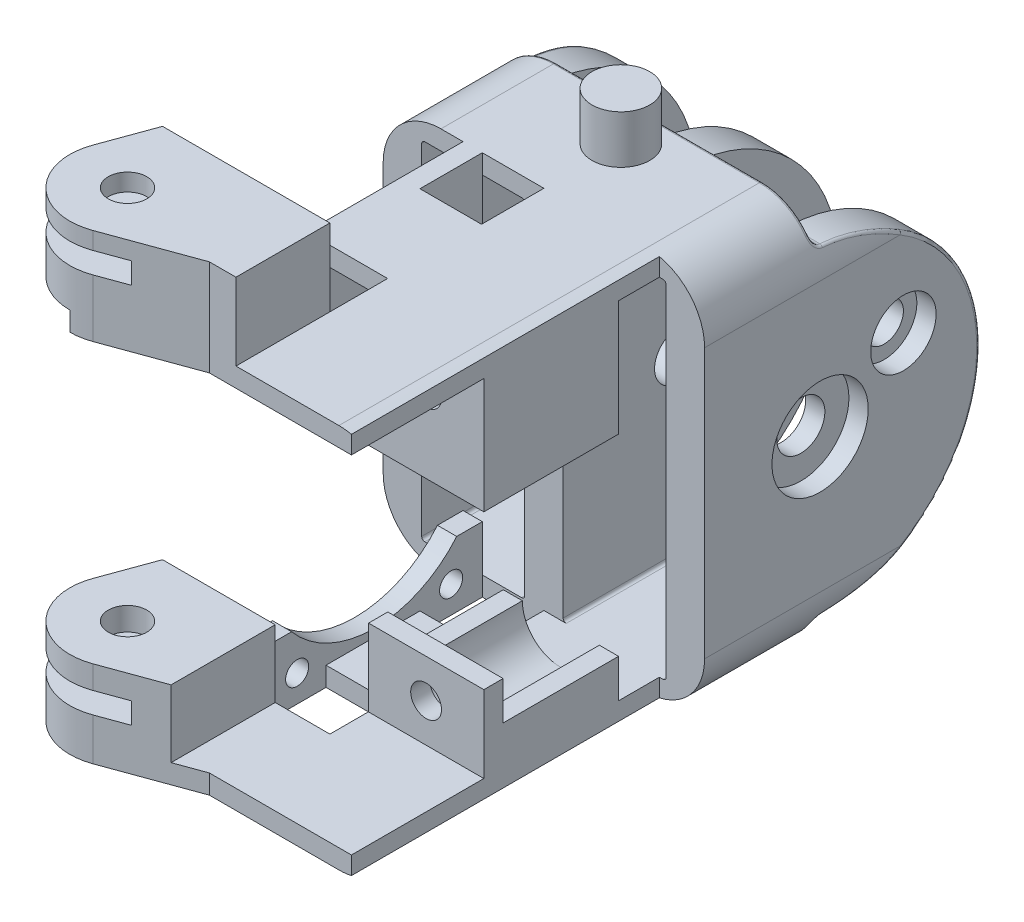
from build123d import *

# Parameters (mm, degrees)
BOSS_EXTRUDE1_DEPTH      = 20
BOSS_EXTRUDE1_DEPTH_BACK = 12
SKETCH1_W                = 16.7
SKETCH1_H                = 20
SKETCH9_R                = 1.5
BOSS_EXTRUDE4_DEPTH      = 2.5
BOSS_EXTRUDE5_START      = 2.5
SKETCH10_R               = 1.5
BOSS_EXTRUDE5_DEPTH      = 2.5
EXTRUDE43_START          = -10
EXTRUDE43_DEPTH          = 20
EXTRUDE44_DEPTH          = 27.982504177
EXTRUDE44_DEPTH_BACK     = 27.982504177
SKETCH_R                 = 1
EXTRUDE45_DEPTH          = 27.982504177
EXTRUDE45_DEPTH_BACK     = 27.982504177
SKETCH67_R               = 1.25
EXTRUDE46_DEPTH          = 27.982504177
EXTRUDE46_DEPTH_BACK     = 27.982504177
EXTRUDE49_DEPTH          = 9
EXTRUDE49_DEPTH_BACK     = 9
SKETCH71_W               = 27.384263627
SKETCH71_H               = 19.636512736
EXTRUDE50_DEPTH          = 29.312186927
EXTRUDE50_DEPTH_BACK     = 29.312186927
SKETCH72_R               = 0.8
EXTRUDE51_DEPTH          = 9
EXTRUDE51_DEPTH_BACK     = 9
SKETCH73_W               = 9.907288935
SKETCH73_H               = 19.904321568
EXTRUDE52_DEPTH          = 9
EXTRUDE52_DEPTH_BACK     = 9
SKETCH74_W               = 5.35
SKETCH74_H               = 6.12
SKETCH74_H_2             = 13.03291784
SKETCH74_H_3             = 12.21702605
EXTRUDE53_DEPTH          = 9
EXTRUDE53_DEPTH_BACK     = 9
SKETCH75_W               = 2
SKETCH75_H               = 2.12
SKETCH75_W_2             = 11.907865897
EXTRUDE54_DEPTH          = 9
EXTRUDE54_DEPTH_BACK     = 9
EXTRUDE55_START          = -6
SKETCH77_R               = 0.8
EXTRUDE55_DEPTH          = 6
SKETCH78_W               = 5.990569302
SKETCH78_H               = 5
EXTRUDE56_DEPTH          = 1
EXTRUDE57_START          = 4
SKETCH79_W               = 15
SKETCH79_H               = 6.5
EXTRUDE57_DEPTH          = 23.982504177
EXTRUDE58_START          = -4.2
SKETCH81_W               = 5.5
SKETCH81_H               = 15
SKETCH81_W_2             = 5.62
SKETCH81_H_2             = 10
EXTRUDE58_DEPTH          = 10
EXTRUDE59_START          = -4.2
SKETCH82_W               = 11.12
SKETCH82_H               = 20
EXTRUDE59_DEPTH          = 1
EXTRUDE60_START          = -4.2
SKETCH83_R               = 0.6
EXTRUDE60_DEPTH          = 2
EXTRUDE61_START          = -3.2
SKETCH84_W               = 3.24
SKETCH84_H               = 10
SKETCH84_W_2             = 3
SKETCH84_H_2             = 4
EXTRUDE61_DEPTH          = 3.2
EXTRUDE62_START          = -4.2
EXTRUDE62_DEPTH          = 1
EXTRUDE63_START          = -6.7
SKETCH86_R               = 2.5
EXTRUDE63_DEPTH          = 1.1
EXTRUDE66_DEPTH          = 1.5
SKETCH96_R               = 1
EXTRUDE69_DEPTH          = 4
EXTRUDE70_DEPTH          = 1
EXTRUDE71_START          = 3.1
SKETCH98_R               = 2.5
EXTRUDE71_DEPTH          = 1.1
EXTRUDE72_DEPTH          = 1
EXTRUDE72_DEPTH_BACK     = 1
EXTRUDE64_DEPTH          = 28.709304064
EXTRUDE64_DEPTH_BACK     = 28.709304064
FILLET23_R               = 1.6
FILLET24_R               = 1.6
EXTRUDE73_DEPTH          = 28.709304064
EXTRUDE73_DEPTH_BACK     = 2
SKETCH101_R              = 1
EXTRUDE74_DEPTH          = 1.5
EXTRUDE75_START          = -7.35
EXTRUDE75_DEPTH          = 21.359304064
EXTRUDE76_START          = 7.35
SKETCH104_R              = 2.5
EXTRUDE76_DEPTH          = 21.359304064
EXTRUDE77_START          = 7.35
SKETCH105_R              = 1.7
EXTRUDE77_DEPTH          = 21.359304064
FILLET25_R               = 3
FILLET26_R               = 0.4
FILLET27_R               = 0.16
FILLET28_R               = 0.16


# Read off the part's stored shape, not the designer's step: Extrude43
with BuildPart() as part:
    # Sketch1 → Boss-Extrude1 (new, two sides: drawn at the far end of the back side and taken through both)
    with BuildSketch(Plane.XY.offset(-BOSS_EXTRUDE1_DEPTH_BACK)):
        Rectangle(SKETCH1_W, SKETCH1_H)
    extrude(amount=BOSS_EXTRUDE1_DEPTH + BOSS_EXTRUDE1_DEPTH_BACK)

    # Sketch9 → Boss-Extrude4 (add)
    with BuildSketch(Plane(origin=(0, 10, 0), x_dir=(1, 0, 0), z_dir=(0, 1, 0))):
        with Locations(Location((0, 0, 0), (0, 0, 270))):
            Circle(SKETCH9_R)
    extrude(amount=BOSS_EXTRUDE4_DEPTH)

    # Sketch10 → Boss-Extrude5 (add)
    with BuildSketch(Plane.XZ.offset(10).offset(BOSS_EXTRUDE5_START)):
        with Locations(Location((0, 0, 0), (0, 0, 90))):
            Circle(SKETCH10_R)
    extrude(amount=-BOSS_EXTRUDE5_DEPTH)

    # Extrude43 outline → Extrude43 (add)
    with BuildSketch(Plane(origin=(0, 0, 0), x_dir=(1, 0, 0), z_dir=(0, 1, 0)).offset(EXTRUDE43_START)):
        with BuildLine():
            ThreePointArc((-9.659480729, -17.767791986), (-8.96172321, -20.915172759), (-5.814342437, -21.612930278))
            Line((-5.814342437, -21.612930278), (-1.382852918, -20))
            Line((-1.382852918, -20), (-8.35, -20))
            Line((-8.35, -20), (-8.35, -14.170023252))
            Line((-8.35, -14.170023252), (-9.659480729, -17.767791986))
        make_face()
    extrude(amount=EXTRUDE43_DEPTH)

    # Sketch → Extrude44 (cut, two sides: drawn at the far end of the back side and taken through both)
    with BuildSketch(Plane(origin=(0, 0, 0), x_dir=(1, 0, 0), z_dir=(0, 1, 0)).offset(-EXTRUDE44_DEPTH_BACK)):
        with Locations(Location((-6.840402867, -18.793852416, 0), (0, 0, 270))):
            Circle(SKETCH_R)
    extrude(amount=EXTRUDE44_DEPTH + EXTRUDE44_DEPTH_BACK, mode=Mode.SUBTRACT)

    # Sketch67 → Extrude45 (cut, two sides: drawn at the far end of the back side and taken through both)
    with BuildSketch(Plane(origin=(0, 0, 0), x_dir=(0, 0, -1), z_dir=(1, 0, 0)).offset(-EXTRUDE45_DEPTH_BACK)):
        with Locations((2, 0)):
            Circle(SKETCH67_R)
    extrude(amount=EXTRUDE45_DEPTH + EXTRUDE45_DEPTH_BACK, mode=Mode.SUBTRACT)

    # Sketch68 → Extrude46 (cut, two sides: drawn at the far end of the back side and taken through both)
    with BuildSketch(Plane(origin=(0, 0, 0), x_dir=(0, 0, -1), z_dir=(1, 0, 0)).offset(-EXTRUDE46_DEPTH_BACK)):
        with BuildLine():
            ThreePointArc((2, -8.3), (10.3, 0), (2, 8.3))
            Line((2, 8.3), (2, 9.5))
            Line((2, 9.5), (2, 10))
            Line((2, 10), (2, 11.538339971))
            Line((2, 11.538339971), (19.192940308, 11.538339971))
            Line((19.192940308, 11.538339971), (19.192940308, -11.441587559))
            Line((19.192940308, -11.441587559), (2, -11.441587559))
            Line((2, -11.441587559), (2, -8.3))
        make_face()
    extrude(amount=EXTRUDE46_DEPTH + EXTRUDE46_DEPTH_BACK, mode=Mode.SUBTRACT)

    # Sketch71 → Extrude49 (cut, two sides: drawn at the far end of the back side and taken through both)
    with BuildSketch(Plane(origin=(0, 0, 0), x_dir=(1, 0, 0), z_dir=(0, 1, 0)).offset(-EXTRUDE49_DEPTH_BACK)):
        with Locations((13.692131814, -22.938256368)):
            Rectangle(SKETCH71_W, SKETCH71_H)
    extrude(amount=EXTRUDE49_DEPTH + EXTRUDE49_DEPTH_BACK, mode=Mode.SUBTRACT)

    # Sketch72 → Extrude50 (cut, two sides: drawn at the far end of the back side and taken through both)
    with BuildSketch(Plane.XY.offset(13.12).offset(-EXTRUDE50_DEPTH_BACK)):
        with Locations((3, 7)):
            Circle(SKETCH72_R)
        with Locations((3, -7)):
            Circle(SKETCH72_R)
    extrude(amount=EXTRUDE50_DEPTH + EXTRUDE50_DEPTH_BACK, mode=Mode.SUBTRACT)

    # Sketch73 → Extrude51 (cut, two sides: drawn at the far end of the back side and taken through both)
    with BuildSketch(Plane(origin=(0, 0, 0), x_dir=(1, 0, 0), z_dir=(0, 1, 0)).offset(-EXTRUDE51_DEPTH_BACK)):
        with Locations((10.953644468, -13.952160784)):
            Rectangle(SKETCH73_W, SKETCH73_H)
    extrude(amount=EXTRUDE51_DEPTH + EXTRUDE51_DEPTH_BACK, mode=Mode.SUBTRACT)

    # Sketch74 → Extrude52 (cut, two sides: drawn at the far end of the back side and taken through both)
    with BuildSketch(Plane(origin=(0, 0, 0), x_dir=(1, 0, 0), z_dir=(0, 1, 0)).offset(-EXTRUDE52_DEPTH_BACK)):
        with Locations((-3.675, -3.06)):
            Rectangle(SKETCH74_W, SKETCH74_H)
        with Locations((-3.675, 6.51645892)):
            Rectangle(SKETCH74_W, SKETCH74_H_2)
        with Locations((3.675, -3.06)):
            Rectangle(SKETCH74_W, SKETCH74_H)
        with Locations((3.675, 6.108513025)):
            Rectangle(SKETCH74_W, SKETCH74_H_3)
    extrude(amount=EXTRUDE52_DEPTH + EXTRUDE52_DEPTH_BACK, mode=Mode.SUBTRACT)

    # Sketch75 → Extrude53 (cut, two sides: drawn at the far end of the back side and taken through both)
    with BuildSketch(Plane(origin=(0, 0, 0), x_dir=(1, 0, 0), z_dir=(0, 1, 0)).offset(-EXTRUDE53_DEPTH_BACK)):
        with Locations((-1, -5.06)):
            Rectangle(SKETCH75_W, SKETCH75_H)
        with Locations((5.953932949, -5.06)):
            Rectangle(SKETCH75_W_2, SKETCH75_H)
    extrude(amount=EXTRUDE53_DEPTH + EXTRUDE53_DEPTH_BACK, mode=Mode.SUBTRACT)

    # Sketch76 → Extrude54 (cut, two sides: drawn at the far end of the back side and taken through both)
    with BuildSketch(Plane(origin=(0, 0, 0), x_dir=(1, 0, 0), z_dir=(0, 1, 0)).offset(-EXTRUDE54_DEPTH_BACK)):
        Polygon((0.009430698, -6.12), (-6.340569302, -6.12), (-6.340569302, -15.12), (-2.840569302, -15.12), (-2.840569302, -18.792969481), (-2.840569302, -26.754770964), (0.009430698, -26.754770964), (0.009430698, -15.12), align=None)
    extrude(amount=EXTRUDE54_DEPTH + EXTRUDE54_DEPTH_BACK, mode=Mode.SUBTRACT)

    # Sketch77 → Extrude55 (cut)
    with BuildSketch(Plane(origin=(0, 0, 6.12), x_dir=(-1, 0, 0), z_dir=(0, 0, -1)).offset(EXTRUDE55_START)):
        with BuildLine():
            Line((-6, 3), (-6, -7))
            Line((-6, -7), (-5, -7))
            ThreePointArc((-5, -7), (-3, -9), (-1, -7))
            Line((-1, -7), (-0.009430698, -7))
            Line((-0.009430698, -7), (-0.009430698, 3))
            Line((-0.009430698, 3), (-1, 3))
            Line((-1, 3), (-1, 7))
            ThreePointArc((-1, 7), (-3, 9), (-5, 7))
            Line((-5, 7), (-5, 3))
            Line((-5, 3), (-6, 3))
        make_face()
        with Locations(Location((-3, -7, 0), (0, 0, 180))):
            Circle(SKETCH77_R, mode=Mode.SUBTRACT)
        with Locations(Location((-3, 7, 0), (0, 0, 180))):
            Circle(SKETCH77_R, mode=Mode.SUBTRACT)
    extrude(amount=EXTRUDE55_DEPTH, mode=Mode.SUBTRACT)

    # Sketch78 → Extrude56 (cut)
    with BuildSketch(Plane(origin=(0, 0, 12.12), x_dir=(-1, 0, 0), z_dir=(0, 0, -1))):
        with Locations((-3.004715349, -2.5)):
            Rectangle(SKETCH78_W, SKETCH78_H)
        Polygon((-6, 3), (-6, 0), (-0.009430698, 0), (-0.009430698, 3), (-1, 3), (-5, 3), align=None)
    extrude(amount=-EXTRUDE56_DEPTH, mode=Mode.SUBTRACT)

    # Sketch79 → Extrude57 (cut, through all)
    with BuildSketch(Plane.XY.offset(EXTRUDE57_START)):
        Polygon((0, 2.5), (-15, 2.5), (-15, -5.5), (0, -5.5), (0, 0), align=None)
        with Locations((-7.5, 5.75)):
            Rectangle(SKETCH79_W, SKETCH79_H)
    extrude(amount=EXTRUDE57_DEPTH, mode=Mode.SUBTRACT)

    # Sketch81 → Extrude58 (cut)
    with BuildSketch(Plane(origin=(0, 0, 0), x_dir=(0, 0, -1), z_dir=(1, 0, 0)).offset(EXTRUDE58_START)):
        with Locations((-12.37, 4.5)):
            Rectangle(SKETCH81_W, SKETCH81_H)
        with Locations((-6.81, 4.5)):
            Rectangle(SKETCH81_W_2, SKETCH81_H)
        with Locations((-6.81, -8)):
            Rectangle(SKETCH81_W_2, SKETCH81_H_2)
        with Locations((-12.37, -8)):
            Rectangle(SKETCH81_W, SKETCH81_H_2)
    extrude(amount=-EXTRUDE58_DEPTH, mode=Mode.SUBTRACT)

    # Sketch82 → Extrude59 (add)
    with BuildSketch(Plane(origin=(0, 0, 0), x_dir=(0, 0, -1), z_dir=(1, 0, 0)).offset(EXTRUDE59_START)):
        with Locations((-9.56, 0)):
            Rectangle(SKETCH82_W, SKETCH82_H)
    extrude(amount=EXTRUDE59_DEPTH)

    # Sketch83 → Extrude60 (cut)
    with BuildSketch(Plane(origin=(0, 0, 0), x_dir=(0, 0, -1), z_dir=(1, 0, 0)).offset(EXTRUDE60_START)):
        with Locations((-5.62, 7.4)):
            Circle(SKETCH83_R)
        with Locations((-13.62, 7.4)):
            Circle(SKETCH83_R)
        with Locations(Location((-5.62, -8.6, 0), (0, 0, 221.810314896))):
            Circle(SKETCH83_R)
        with Locations(Location((-13.62, -8.6, 0), (0, 0, 221.810314896))):
            Circle(SKETCH83_R)
    extrude(amount=EXTRUDE60_DEPTH, mode=Mode.SUBTRACT)

    # Sketch84 → Extrude61 (cut)
    with BuildSketch(Plane(origin=(0, 0, 0), x_dir=(0, 0, -1), z_dir=(1, 0, 0)).offset(EXTRUDE61_START)):
        with Locations((-5.62, 7.4)):
            Rectangle(SKETCH84_W, SKETCH84_H)
        with Locations((-13.62, 7.4)):
            Rectangle(SKETCH84_W_2, SKETCH84_H)
        with Locations((-5.62, -8.6)):
            Rectangle(SKETCH84_W, SKETCH84_H_2)
        with Locations((-13.62, -8.6)):
            Rectangle(SKETCH84_W_2, SKETCH84_H_2)
    extrude(amount=EXTRUDE61_DEPTH, mode=Mode.SUBTRACT)

    # Sketch85 → Extrude62 (cut)
    with BuildSketch(Plane(origin=(0, 0, 0), x_dir=(0, 0, -1), z_dir=(1, 0, 0)).offset(EXTRUDE62_START)):
        with BuildLine():
            Line((-4, 5.4), (-9.62, 5.4))
            Line((-9.62, 5.4), (-9.62, 2.6))
            ThreePointArc((-9.62, 2.6), (-5.660202025, 0.959797975), (-4.02, -3))
            ThreePointArc((-4.02, -3), (-4.357808258, -4.915551636), (-5.330477882, -6.6))
            Line((-5.330477882, -6.6), (-4, -6.6))
            Line((-4, -6.6), (-4, 5.4))
        make_face()
        with BuildLine():
            Line((-9.62, 2.6), (-9.62, 5.4))
            Line((-9.62, 5.4), (-15.12, 5.4))
            Line((-15.12, 5.4), (-15.12, -1.946434625))
            ThreePointArc((-15.12, -1.946434625), (-13.18791493, 1.316246408), (-9.62, 2.6))
        make_face()
        with BuildLine():
            ThreePointArc((-4.02, -3), (-5.660202025, 0.959797975), (-9.62, 2.6))
            Line((-9.62, 2.6), (-9.62, -3))
            Line((-9.62, -3), (-9.62, -6.6))
            Line((-9.62, -6.6), (-5.330477882, -6.6))
            ThreePointArc((-5.330477882, -6.6), (-4.357808258, -4.915551636), (-4.02, -3))
        make_face()
        with BuildLine():
            Line((-9.62, -3), (-9.62, 2.6))
            ThreePointArc((-9.62, 2.6), (-13.18791493, 1.316246408), (-15.12, -1.946434625))
            Line((-15.12, -1.946434625), (-15.12, -4.053565375))
            ThreePointArc((-15.12, -4.053565375), (-14.677644526, -5.404211274), (-13.909522118, -6.6))
            Line((-13.909522118, -6.6), (-9.62, -6.6))
            Line((-9.62, -6.6), (-9.62, -3))
        make_face()
        with BuildLine():
            ThreePointArc((-13.909522118, -6.6), (-9.62, -8.6), (-5.330477882, -6.6))
            Line((-5.330477882, -6.6), (-9.62, -6.6))
            Line((-9.62, -6.6), (-13.909522118, -6.6))
        make_face()
        with BuildLine():
            ThreePointArc((-13.909522118, -6.6), (-14.677644526, -5.404211274), (-15.12, -4.053565375))
            Line((-15.12, -4.053565375), (-15.12, -6.6))
            Line((-15.12, -6.6), (-13.909522118, -6.6))
        make_face()
    extrude(amount=EXTRUDE62_DEPTH, mode=Mode.SUBTRACT)

    # Sketch86 → Extrude63 (cut)
    with BuildSketch(Plane(origin=(0, 0, 0), x_dir=(1, 0, 0), z_dir=(0, 1, 0)).offset(EXTRUDE63_START)):
        with BuildLine():
            ThreePointArc((-4.340402867, -18.793852416), (-8.608169819, -20.561619369), (-6.840402867, -16.293852416))
            Line((-6.840402867, -16.293852416), (-11.170529885, -16.293852416))
            ThreePointArc((-11.170529885, -16.293852416), (-10.375936772, -22.329386322), (-4.340402867, -23.123979435))
            Line((-4.340402867, -23.123979435), (-4.340402867, -18.793852416))
        make_face()
        with Locations((-6.840402867, -18.793852416)):
            Circle(SKETCH86_R)
    extrude(amount=-EXTRUDE63_DEPTH, mode=Mode.SUBTRACT)

    # Sketch90 → Extrude66 (cut)
    with BuildSketch(Plane.XZ.offset(10)):
        Polygon((-8.803393782, 18.793852416), (-7.821898324, 17.093852416), (-5.858907409, 17.093852416), (-4.877411951, 18.793852416), (-5.858907409, 20.493852416), (-7.821898324, 20.493852416), align=None)
    extrude(amount=-EXTRUDE66_DEPTH, mode=Mode.SUBTRACT)

    # Sketch96 → Extrude69 (add)
    with BuildSketch(Plane(origin=(0, 10, 0), x_dir=(1, 0, 0), z_dir=(0, 1, 0))):
        with BuildLine():
            Line((-8.69576326, -15.12), (-9.659480729, -17.767791986))
            ThreePointArc((-9.659480729, -17.767791986), (-8.96172321, -20.915172759), (-5.814342437, -21.612930278))
            Line((-5.814342437, -21.612930278), (-1.382852918, -20))
            Line((-1.382852918, -20), (0, -20))
            Line((0, -20), (0, -15.12))
            Line((0, -15.12), (-8.69576326, -15.12))
        make_face()
        with Locations(Location((-6.840402867, -18.793852416, 0), (0, 0, 270))):
            Circle(SKETCH96_R, mode=Mode.SUBTRACT)
    extrude(amount=EXTRUDE69_DEPTH)

    # Sketch97 → Extrude70 (cut)
    with BuildSketch(Plane.XZ.offset(-9)):
        with BuildLine():
            Line((-10.922231336, 18.793852416), (-9.840402867, 18.793852416))
            ThreePointArc((-9.840402867, 18.793852416), (-8.96172321, 20.915172759), (-6.840402867, 21.793852416))
            Line((-6.840402867, 21.793852416), (-6.840402867, 23.19317095))
            Line((-6.840402867, 23.19317095), (-10.922231336, 23.19317095))
            Line((-10.922231336, 23.19317095), (-10.922231336, 18.793852416))
        make_face()
        with BuildLine():
            ThreePointArc((-6.840402867, 17.793852416), (-7.547509648, 18.086745635), (-7.840402867, 18.793852416))
            Line((-7.840402867, 18.793852416), (-9.840402867, 18.793852416))
            ThreePointArc((-9.840402867, 18.793852416), (-9.794826126, 18.272907883), (-9.659480729, 17.767791986))
            Line((-9.659480729, 17.767791986), (-8.69576326, 15.12))
            Line((-8.69576326, 15.12), (-6.840402867, 15.12))
            Line((-6.840402867, 15.12), (-6.840402867, 17.793852416))
        make_face()
        with BuildLine():
            Line((-9.840402867, 18.793852416), (-7.840402867, 18.793852416))
            ThreePointArc((-7.840402867, 18.793852416), (-7.547509648, 19.500959197), (-6.840402867, 19.793852416))
            Line((-6.840402867, 19.793852416), (-6.840402867, 21.793852416))
            ThreePointArc((-6.840402867, 21.793852416), (-8.96172321, 20.915172759), (-9.840402867, 18.793852416))
        make_face()
        with BuildLine():
            Line((-6.840402867, 17.793852416), (-6.840402867, 18.793852416))
            Line((-6.840402867, 18.793852416), (-7.840402867, 18.793852416))
            ThreePointArc((-7.840402867, 18.793852416), (-7.547509648, 18.086745635), (-6.840402867, 17.793852416))
        make_face()
        with BuildLine():
            Line((-7.840402867, 18.793852416), (-6.840402867, 18.793852416))
            Line((-6.840402867, 18.793852416), (-6.840402867, 19.793852416))
            ThreePointArc((-6.840402867, 19.793852416), (-7.547509648, 19.500959197), (-7.840402867, 18.793852416))
        make_face()
        with BuildLine():
            ThreePointArc((-9.659480729, 17.767791986), (-9.794826126, 18.272907883), (-9.840402867, 18.793852416))
            Line((-9.840402867, 18.793852416), (-10.922231336, 18.793852416))
            Line((-10.922231336, 18.793852416), (-10.922231336, 13.727688764))
            Line((-10.922231336, 13.727688764), (-6.840402867, 13.727688764))
            Line((-6.840402867, 13.727688764), (-6.840402867, 15.12))
            Line((-6.840402867, 15.12), (-8.69576326, 15.12))
            Line((-8.69576326, 15.12), (-9.659480729, 17.767791986))
        make_face()
    extrude(amount=-EXTRUDE70_DEPTH, mode=Mode.SUBTRACT)

    # Sketch98 → Extrude71 (cut)
    with BuildSketch(Plane(origin=(0, 10, 0), x_dir=(1, 0, 0), z_dir=(0, 1, 0)).offset(EXTRUDE71_START)):
        with BuildLine():
            ThreePointArc((-4.340402867, -18.793852416), (-8.608169819, -20.561619369), (-6.840402867, -16.293852416))
            Line((-6.840402867, -16.293852416), (-11.170529885, -16.293852416))
            ThreePointArc((-11.170529885, -16.293852416), (-10.375936772, -22.329386322), (-4.340402867, -23.123979435))
            Line((-4.340402867, -23.123979435), (-4.340402867, -18.793852416))
        make_face()
        with Locations((-6.840402867, -18.793852416)):
            Circle(SKETCH98_R)
    extrude(amount=-EXTRUDE71_DEPTH, mode=Mode.SUBTRACT)

    # Sketch99 → Extrude72 (cut, two sides: drawn at the far end of the back side and taken through both)
    with BuildSketch(Plane.XZ.offset(-10).offset(-EXTRUDE72_DEPTH_BACK)):
        Polygon((-6.840402867, 20.756843331), (-8.540402867, 19.775347873), (-8.540402867, 17.812356958), (-6.840402867, 16.8308615), (-5.140402867, 17.812356958), (-5.140402867, 19.775347873), align=None)
    extrude(amount=EXTRUDE72_DEPTH + EXTRUDE72_DEPTH_BACK, mode=Mode.SUBTRACT)

    # Sketch87 → Extrude64 (cut, two sides: drawn at the far end of the back side and taken through both)
    with BuildSketch(Plane(origin=(0, 0, 0), x_dir=(1, 0, 0), z_dir=(0, 1, 0)).offset(-EXTRUDE64_DEPTH_BACK)):
        Polygon((14.945243079, -4), (6.35, -4), (6, -4), (6, -22.025847639), (14.945243079, -22.025847639), align=None)
    extrude(amount=EXTRUDE64_DEPTH + EXTRUDE64_DEPTH_BACK, mode=Mode.SUBTRACT)

    # Fillet23
    fillet23_edges = [part.edges().sort_by_distance(p)[0] for p in [
        (-3.7, 9, 15.12),
    ]]
    fillet(fillet23_edges, radius=FILLET23_R)

    # Fillet24
    fillet24_edges = [part.edges().sort_by_distance(p)[0] for p in [
        (-3.7, 10, 15.12),
    ]]
    fillet(fillet24_edges, radius=FILLET24_R)

    # Sketch101 → Extrude73 (cut, two sides: drawn at the far end of the back side and taken through both)
    with BuildSketch(Plane(origin=(0, 0, 0), x_dir=(0, 0, -1), z_dir=(1, 0, 0)).offset(-EXTRUDE73_DEPTH_BACK)):
        with Locations((6.330127019, 2.5)):
            Circle(SKETCH101_R)
    extrude(amount=EXTRUDE73_DEPTH + EXTRUDE73_DEPTH_BACK, mode=Mode.SUBTRACT)

    # Sketch102 → Extrude74 (cut)
    with BuildSketch(Plane.ZY.offset(1)):
        Polygon((-6.330127019, 4.462990915), (-8.030127019, 3.481495458), (-8.030127019, 1.518504542), (-6.330127019, 0.537009085), (-4.630127019, 1.518504542), (-4.630127019, 3.481495458), align=None)
    extrude(amount=-EXTRUDE74_DEPTH, mode=Mode.SUBTRACT)

    # Sketch103 → Extrude75 (cut, through all)
    with BuildSketch(Plane(origin=(0, 0, 0), x_dir=(0, 0, -1), z_dir=(1, 0, 0)).offset(EXTRUDE75_START)):
        Polygon((2, 2.886751346), (-0.5, 1.443375673), (-0.5, -1.443375673), (2, -2.886751346), (4.5, -1.443375673), (4.5, 1.443375673), align=None)
    extrude(amount=-EXTRUDE75_DEPTH, mode=Mode.SUBTRACT)

    # Sketch104 → Extrude76 (cut, through all)
    with BuildSketch(Plane(origin=(0, 0, 0), x_dir=(0, 0, -1), z_dir=(1, 0, 0)).offset(EXTRUDE76_START)):
        with Locations((2, 0)):
            Circle(SKETCH104_R)
    extrude(amount=EXTRUDE76_DEPTH, mode=Mode.SUBTRACT)

    # Sketch105 → Extrude77 (cut, through all)
    with BuildSketch(Plane(origin=(0, 0, 0), x_dir=(0, 0, -1), z_dir=(1, 0, 0)).offset(EXTRUDE77_START)):
        with Locations((6.330127019, 2.5)):
            Circle(SKETCH105_R)
    extrude(amount=EXTRUDE77_DEPTH, mode=Mode.SUBTRACT)

    # Fillet25
    fillet25_edges = [part.edges().sort_by_distance(p)[0] for p in [
        (-8.35, -10, 1),
        (8.35, -10, 1),
        (-8.35, 10, 1),
        (8.35, 10, 1),
    ]]
    fillet(fillet25_edges, radius=FILLET25_R)

    # Fillet26
    fillet26_edges = [part.edges().sort_by_distance(p)[0] for p in [
        (-7.201850583, -8.3, -2),
        (0, -8.3, -2),
        (7.201850583, -8.3, -2),
        (7.201850583, 8.3, -2),
        (-7.201850583, 8.3, -2),
        (0, 8.3, -2),
    ]]
    fillet(fillet26_edges, radius=FILLET26_R)

    # Fillet27
    fillet27_edges = [part.edges().sort_by_distance(p)[0] for p in [
        (-8.35, 0, -10.3),
        (0, -10, -2),
        (-6.751356629, -9.652583571, -2),
        (-8.207733346, 7.912885637, -4.505242684),
        (8.35, 0, -10.3),
        (8.207733347, -7.912885637, -4.505242684),
        (0, 10, -2),
        (6.751356629, 9.652583571, -2),
        (6.751356629, -9.652583571, -2),
        (-8.207733347, -7.912885637, -4.505242684),
        (8.207733346, 7.912885637, -4.505242684),
        (-6.751356629, 9.652583571, -2),
        (-7.988976237, -8.426816224, -2.099479305),
        (7.988976237, -8.426816224, -2.099479305),
        (7.988976237, 8.426816224, -2.099479305),
        (-7.988976237, 8.426816224, -2.099479305),
    ]]
    fillet(fillet27_edges, radius=FILLET27_R)

    # Fillet28
    fillet28_edges = [part.edges().sort_by_distance(p)[0] for p in [
        (-6.35, 9, 1),
        (-1, 9, 1),
        (-6.35, -9, 1),
        (-1, -9, 1),
        (1, -9, 1),
        (6.35, 9, 1),
        (1, 9, 1),
        (6.35, -9, 1),
    ]]
    fillet(fillet28_edges, radius=FILLET28_R)


solid = part.part
